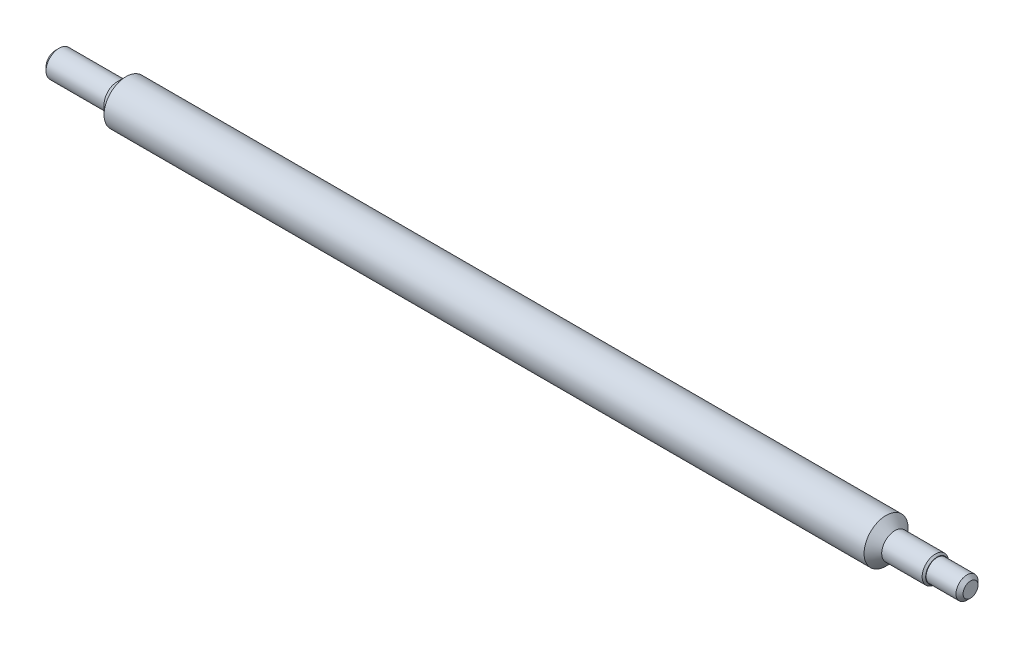
from build123d import *

# Parameters (mm, degrees)
SKETCH_1_R          = 2.5
EXTRUDE_1_DEPTH     = 100
CUT_EXTRUDE_START   = -3.8
SKETCH_15_R         = 1.5
SKETCH_15_R_2       = 1.25
CUT_EXTRUDE_1_DEPTH = 3.8
CHAMFER_2_SIZE      = 0.2
CHAMFER_3_SIZE      = 0.4
EXTRUDE_START       = 4
SKETCH_16_R         = 1.5
EXTRUDE_2_DEPTH     = 4
CHAMFER_4_SIZE      = 0.4


with BuildPart() as part:
    # Эскиз1 → Бобышка-Вытянуть1 (new body)
    with BuildSketch(Plane(origin=(0, 0, 0), x_dir=(0, 0, -1), z_dir=(1, 0, 0))):
        Circle(SKETCH_1_R)
    extrude(amount=EXTRUDE_1_DEPTH)

    # Эскиз13 → Вырез-Повернуть1 (revolve, cut)
    with BuildSketch(Plane(origin=(0, 0, 0), x_dir=(1, 0, 0), z_dir=(0, 1, 0))):
        Polygon((3, -1.5), (0, -1.5), (0, -2.5), (4, -2.5), align=None)
    revolve(axis=Axis((0, 0, 0), (1, 0, 0)), mode=Mode.SUBTRACT)

    # Эскиз14 → Вырез-Повернуть9 (revolve, cut)
    with BuildSketch(Plane.XY):
        Polygon((100, 1.5), (91.4, 1.5), (90.4, 2.5), (100, 2.5), align=None)
    revolve(axis=Axis((100, 0, 0), (-1, 0, 0)), mode=Mode.SUBTRACT)

    # Эскиз15 → Вырез-Вытянуть1 (cut)
    with BuildSketch(Plane(origin=(100, 0, 0), x_dir=(0, 0, -1), z_dir=(1, 0, 0)).offset(CUT_EXTRUDE_START)):
        Circle(SKETCH_15_R)
        Circle(SKETCH_15_R_2, mode=Mode.SUBTRACT)
    extrude(amount=CUT_EXTRUDE_1_DEPTH, mode=Mode.SUBTRACT)

    # Фаска2
    chamfer_2_edges = [part.edges().sort_by_distance(p)[0] for p in [
        (96.2, -1.5, 0),
    ]]
    chamfer(chamfer_2_edges, length=CHAMFER_2_SIZE)

    # Фаска3
    chamfer_3_edges = [part.edges().sort_by_distance(p)[0] for p in [
        (100, 0, 1.25),
    ]]
    chamfer(chamfer_3_edges, length=CHAMFER_3_SIZE)

    # Эскиз16 → Бобышка-Вытянуть2 (add)
    with BuildSketch(Plane.ZY.offset(EXTRUDE_START)):
        Circle(SKETCH_16_R)
    extrude(amount=-EXTRUDE_2_DEPTH)

    # Фаска4
    chamfer_4_edges = [part.edges().sort_by_distance(p)[0] for p in [
        (-4, 0, -1.5),
    ]]
    chamfer(chamfer_4_edges, length=CHAMFER_4_SIZE)


solid = part.part
